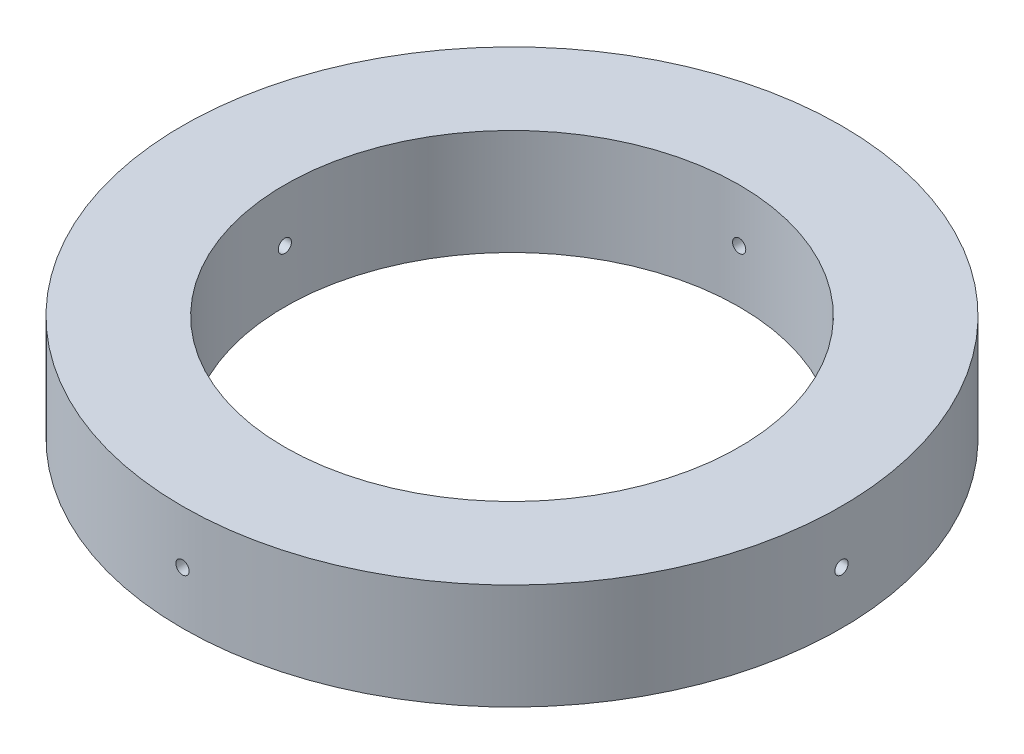
from build123d import *

# Parameters (mm, degrees)
CROQUIS1_R                 = 62.36
CROQUIS1_R_2               = 43
SALIENTE_EXTRUIR1_DEPTH    = 20
CORTAR_EXTRUIR1_REACH      = 92.43
CORTAR_EXTRUIR1_END_RADIUS = 62.36
CROQUIS2_R                 = 1.25
MATRIZC1_COUNT             = 4


with BuildPart() as part:
    # Croquis1 → Saliente-Extruir1 (new body)
    with BuildSketch(Plane(origin=(0, 0, 0), x_dir=(1, 0, 0), z_dir=(0, 1, 0))):
        Circle(CROQUIS1_R)
        Circle(CROQUIS1_R_2, mode=Mode.SUBTRACT)
    extrude(amount=SALIENTE_EXTRUIR1_DEPTH)

    # Cortar-Extruir1: up to this cylinder (the profile starts inside it)
    cortar_extruir1_end = Plane(origin=(0, 10, 0), z_dir=(0, -1, 0)) * Cylinder(CORTAR_EXTRUIR1_END_RADIUS, 310.58, mode=Mode.PRIVATE)
    # Croquis2 → Cortar-Extruir1 (cut, up to the surface)
    with BuildSketch(Plane.XY, mode=Mode.PRIVATE) as cortar_extruir1_sk1:
        with Locations((0, 10)):
            Circle(CROQUIS2_R)
    cortar_extruir1_tool1 = extrude(cortar_extruir1_sk1.sketch, amount=-CORTAR_EXTRUIR1_REACH, mode=Mode.PRIVATE) & cortar_extruir1_end
    cortar_extruir1 = cortar_extruir1_tool1.solids().sort_by_distance((0, 10, 0))[0]
    add(cortar_extruir1, mode=Mode.SUBTRACT)

    # MatrizC1: Cortar-Extruir1 ×4 about axis
    matrizc1_axis = Axis((0, 20, 0), (0, 1, 0))
    for i in range(1, MATRIZC1_COUNT):
        add(cortar_extruir1.rotate(matrizc1_axis, i * 360 / MATRIZC1_COUNT), mode=Mode.SUBTRACT)


solid = part.part
